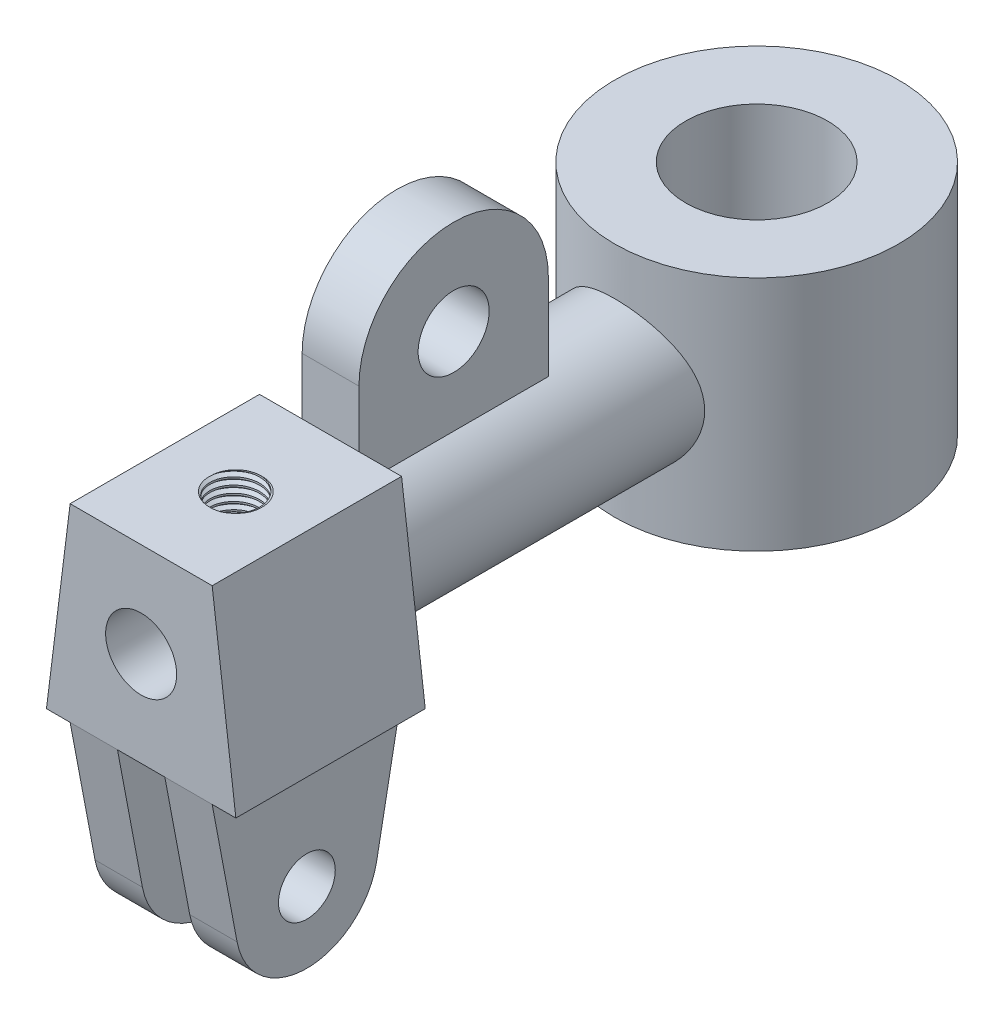
from build123d import *

# Parameters (mm, degrees)
SKETCH1_R                       = 30
SKETCH1_R_2                     = 15
BOSS_EXTRUDE1_DEPTH             = 25
SKETCH2_R                       = 15
BOSS_EXTRUDE2_DEPTH             = 40
BOSS_EXTRUDE3_REACH             = 166.697
SKETCH2_3_R                     = 15
CUT_EXTRUDE1_REACH              = 166.697
CUT_EXTRUDE1_END_RADIUS         = 15
SKETCH3_R                       = 7.5
BOSS_EXTRUDE5_START             = 5
SKETCH5_R                       = 6
BOSS_EXTRUDE5_DEPTH             = 10
SKETCH6_W                       = 12
SKETCH6_H                       = 40
BOSS_EXTRUDE6_DEPTH             = 32
BOSS_EXTRUDE6_DIRECTION_2_REACH = 157.563
FILLET1_RADIUS                  = 20
FILLET1_LENGTH                  = 12
F_6_0MM_DOWEL_HOLE1_D           = 15
M12X1_5_TAPPED_HOLE1_REACH      = 157.563
M12X1_5_TAPPED_HOLE1_BORE_R     = 5.25
THREAD3_PITCH                   = 1.5


with BuildPart() as part:
    # Sketch1 → Boss-Extrude1 (new, symmetric)
    with BuildSketch(Plane(origin=(0, 0, 0), x_dir=(1, 0, 0), z_dir=(0, 1, 0))):
        with Locations(Location((0, 0, 0), (0, 0, 270))):
            Circle(SKETCH1_R)
        with Locations(Location((0, 0, 0), (0, 0, 270))):
            Circle(SKETCH1_R_2, mode=Mode.SUBTRACT)
    extrude(amount=BOSS_EXTRUDE1_DEPTH, both=True)

    # Sketch2<3> → Boss-Extrude3 (add, up to next)
    with BuildSketch(Plane.XY.offset(130), mode=Mode.PRIVATE) as boss_extrude3_sk1:
        Circle(SKETCH2_3_R)
    boss_extrude3_tool1 = extrude(boss_extrude3_sk1.sketch, amount=-BOSS_EXTRUDE3_REACH, mode=Mode.PRIVATE) - part.part


with BuildPart() as body_2:
    # Sketch2 → Boss-Extrude2 (new body)
    with BuildSketch(Plane.XY.offset(130)):
        Polygon((-20, -20), (20, -20), (15, 20), (-15, 20), align=None)
        Circle(SKETCH2_R, mode=Mode.SUBTRACT)
    extrude(amount=-BOSS_EXTRUDE2_DEPTH)


with BuildPart() as part_1:
    add(part.part)

    add(body_2.part)  # Boss-Extrude3 merges body 2
    add(boss_extrude3_tool1.solids().sort_by_distance((0, 0, 130))[0])

    # Cut-Extrude1: up to this cylinder (the profile starts outside it)
    cut_extrude1_end = Plane(origin=(0, 0, 0), z_dir=(0, -1, 0)) * Cylinder(CUT_EXTRUDE1_END_RADIUS, 364.394, mode=Mode.PRIVATE)
    # Sketch3 → Cut-Extrude1 (cut, up to the surface)
    with BuildSketch(Plane.XY.offset(130), mode=Mode.PRIVATE) as cut_extrude1_sk1:
        Circle(SKETCH3_R)
    cut_extrude1_tool1 = extrude(cut_extrude1_sk1.sketch, amount=-CUT_EXTRUDE1_REACH, mode=Mode.PRIVATE) - cut_extrude1_end
    add(cut_extrude1_tool1.solids().sort_by_distance((0, 0, 130))[0], mode=Mode.SUBTRACT)

    # Sketch5 → Boss-Extrude5 (add)
    with BuildSketch(Plane(origin=(0, 0, 0), x_dir=(0, 0, -1), z_dir=(1, 0, 0)).offset(BOSS_EXTRUDE5_START)):
        with BuildLine():
            Line((-90, -20), (-95.261851983, -47.790518414))
            ThreePointArc((-95.261851983, -47.790518414), (-110, -60), (-124.738148017, -47.790518414))
            Line((-124.738148017, -47.790518414), (-130, -20))
            Line((-130, -20), (-90, -20))
        make_face()
        with Locations((-110, -45)):
            Circle(SKETCH5_R, mode=Mode.SUBTRACT)
    boss_extrude5 = extrude(amount=BOSS_EXTRUDE5_DEPTH)

    # Mirror1: Boss-Extrude5 across plane
    add(boss_extrude5.mirror(Plane(origin=(0, 0, 0), x_dir=(0, 0, 1), z_dir=(1, 0, 0))))

    # Sketch6 → Boss-Extrude6 (add)
    with BuildSketch(Plane(origin=(0, 20, 0), x_dir=(1, 0, 0), z_dir=(0, 1, 0))):
        with Locations((0, -70)):
            Rectangle(SKETCH6_W, SKETCH6_H)
    extrude(amount=BOSS_EXTRUDE6_DEPTH)

    # Sketch6 → Boss-Extrude6 direction 2 (add, up to next)
    with BuildSketch(Plane(origin=(0, 20, 0), x_dir=(1, 0, 0), z_dir=(0, 1, 0)), mode=Mode.PRIVATE) as boss_extrude6_direction_2_sk1:
        with Locations((0, -70)):
            Rectangle(SKETCH6_W, SKETCH6_H)
    boss_extrude6_direction_2_tool1 = extrude(boss_extrude6_direction_2_sk1.sketch, amount=-BOSS_EXTRUDE6_DIRECTION_2_REACH, mode=Mode.PRIVATE) - part_1.part
    add(boss_extrude6_direction_2_tool1.solids().sort_by_distance((0, 20, 70))[0])

    # Fillet1: full round fillet: the end face becomes a half cylinder, R = half its width
    fillet1_face = Plane((0, 52, 70), x_dir=(1, 0, 0), z_dir=(0, 1, 0))  # on the end face: x along it, z out of the body
    fillet1_slab = fillet1_face.offset(-FILLET1_RADIUS / 2) * Box(FILLET1_LENGTH, 2 * FILLET1_RADIUS, FILLET1_RADIUS, mode=Mode.PRIVATE)  # the body's end, R deep
    fillet1_round = Plane((0, 32, 70), x_dir=(0, 1, 0), z_dir=(1, 0, 0)) * Cylinder(FILLET1_RADIUS, FILLET1_LENGTH, mode=Mode.PRIVATE)  # its axis R under the face
    add(fillet1_slab - fillet1_round, mode=Mode.SUBTRACT)

    # Ø6.0mm Dowel Hole1 (through all)
    with Locations(Plane(origin=(6, 0, 0), x_dir=(0, 0, -1), z_dir=(1, 0, 0))):
        with Locations((-70, 32)):
            Hole(F_6_0MM_DOWEL_HOLE1_D / 2)

    # M12x1.5 Tapped Hole1 bore → M12x1.5 Tapped Hole1 (cut, up to next)
    with BuildSketch(Plane(origin=(0, 20, 0), x_dir=(1, 0, 0), z_dir=(0, 1, 0)), mode=Mode.PRIVATE) as m12x1_5_tapped_hole1_sk1:
        with Locations((0, -110)):
            Circle(M12X1_5_TAPPED_HOLE1_BORE_R)
    m12x1_5_tapped_hole1_tool1 = extrude(m12x1_5_tapped_hole1_sk1.sketch, amount=-M12X1_5_TAPPED_HOLE1_REACH, mode=Mode.PRIVATE) & part_1.part
    add(m12x1_5_tapped_hole1_tool1.solids().sort_by_distance((0, 20, 110))[0], mode=Mode.SUBTRACT)

    # Thread3: the profile of Thread Profile3 profile screwed along a right-hand helix of 13.333333 turns, 8 arcs to a turn; built about Z, then put on its axis
    thread3_z = Axis((0, 0, 0), (0, 0, 1))
    thread3_corners = [(5.2497, 0, -0.000173205), (6.061898812, 0, 0.468749998), (6.061898812, 0, 0.656249998), (5.2497, 0, 1.125173201)]
    with BuildLine(mode=Mode.PRIVATE) as thread3_profile:
        Line(thread3_corners[0], thread3_corners[1])
        Line(thread3_corners[1], thread3_corners[2])
        Line(thread3_corners[2], thread3_corners[3])
        Line(thread3_corners[3], thread3_corners[0])
    thread3_cap = Face(thread3_profile.wire())
    thread3_turn_angles = [0, 22.5, 45, 67.5, 90, 112.5, 135, 157.5, 180, 202.5, 225, 247.5, 270, 292.5, 315, 337.5, 360]
    thread3_turn_weights = [1, 0.9238795325112867, 1, 0.9238795325112867, 1, 0.9238795325112867, 1, 0.9238795325112867, 1, 0.9238795325112867, 1, 0.9238795325112867, 1, 0.9238795325112867, 1, 0.9238795325112867, 1]
    thread3_turn_rails = [Edge.make_bspline([Vector(p[0], p[1], 0).rotate(thread3_z, thread3_turn_angles[k]) / thread3_turn_weights[k] + Vector(0, 0, p[2] + THREAD3_PITCH * thread3_turn_angles[k] / 360) for k in range(17)], [0, 0, 0, 1, 1, 2, 2, 3, 3, 4, 4, 5, 5, 6, 6, 7, 7, 8, 8, 8], 2, thread3_turn_weights) for p in thread3_corners]
    thread3_turn_sides = [Face.make_surface_from_curves(thread3_turn_rails[p[0]], thread3_turn_rails[p[1]]) for p in [(0, 1), (1, 2), (2, 3), (3, 0)]]
    thread3_last_angles = [4680, 4702.5, 4725, 4747.5, 4770, 4785, 4800]
    thread3_last_weights = [1, 0.9238795325112867, 1, 0.9238795325112867, 1, 0.9659258262890703, 1]
    thread3_last_rails = [Edge.make_bspline([Vector(p[0], p[1], 0).rotate(thread3_z, thread3_last_angles[k]) / thread3_last_weights[k] + Vector(0, 0, p[2] + THREAD3_PITCH * thread3_last_angles[k] / 360) for k in range(7)], [0, 0, 0, 1, 1, 2, 2, 3, 3, 3], 2, thread3_last_weights) for p in thread3_corners]
    thread3_last_sides = [Face.make_surface_from_curves(thread3_last_rails[p[0]], thread3_last_rails[p[1]]) for p in [(0, 1), (1, 2), (2, 3), (3, 0)]]
    thread3 = Plane(origin=(0, 21.5, 110), x_dir=(-1, 0, 0), z_dir=(0, -1, 0)) * Solid(Shell([*[p.moved(Location((0, 0, THREAD3_PITCH * i))) for i in range(13) for p in thread3_turn_sides], *thread3_last_sides, thread3_cap, thread3_cap.rotate(thread3_z, 4800).moved(Location((0, 0, THREAD3_PITCH * 4800 / 360)))]))
    add(thread3, mode=Mode.SUBTRACT)


solid = part_1.part
